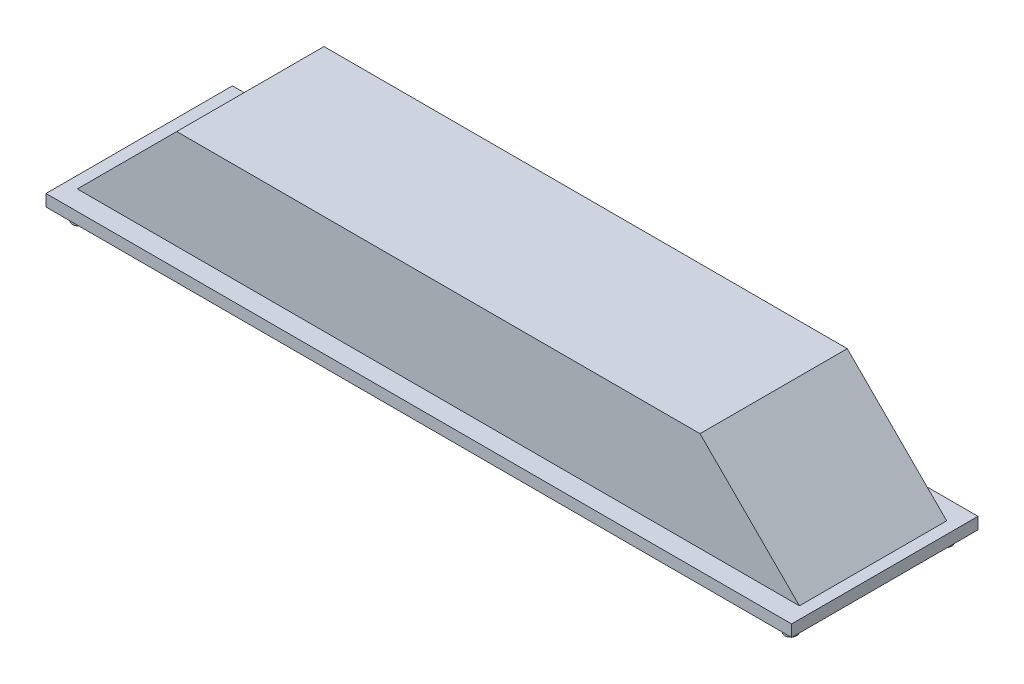
from build123d import *

# Parameters (mm, degrees)
SKETCH1_W               = 76.2
SKETCH1_H               = 19.05
BOSS_EXTRUDE1_DEPTH     = 1.2
BOSS_EXTRUDE2_START     = -2
BOSS_EXTRUDE2_DEPTH     = 15.05
SHELL1_START            = -6.325
SHELL1_DEPTH            = 12.65
SKETCH3_R               = 0.6
BOSS_EXTRUDE3_DEPTH     = 1.2
MIRROR2_COPY_1_SKETCH_R = 0.6
MIRROR2_COPY_1_DEPTH    = 1.2


# Read off the part's stored shape, not the designer's step: Shell1
with BuildPart() as part:
    # Sketch1 → Boss-Extrude1 (new body)
    with BuildSketch(Plane(origin=(0, 0, 0), x_dir=(1, 0, 0), z_dir=(0, 1, 0))):
        Rectangle(SKETCH1_W, SKETCH1_H)
    extrude(amount=BOSS_EXTRUDE1_DEPTH)

    # Sketch2 → Boss-Extrude2 (add)
    with BuildSketch(Plane.XY.offset(9.525).offset(BOSS_EXTRUDE2_START)):
        Polygon((-36.9, 1.2), (-26.74, 11.36), (26.74, 11.36), (36.9, 1.2), align=None)
    extrude(amount=-BOSS_EXTRUDE2_DEPTH)

    # Shell1 outline → Shell1 (cut)
    with BuildSketch(Plane.XY.offset(SHELL1_START)):
        Polygon((26.242943725, 10.16), (-26.242943725, 10.16), (-36.402943725, 0), (36.402943725, 0), align=None)
    extrude(amount=SHELL1_DEPTH, mode=Mode.SUBTRACT)

    # Sketch3 → Boss-Extrude3 (add)
    with BuildSketch(Plane.XZ):
        with Locations(Location((-36.402943725, 7.924066334, 0), (0, 0, 90))):
            Circle(SKETCH3_R)
    boss_extrude3 = extrude(amount=BOSS_EXTRUDE3_DEPTH)

    # Mirror1: Boss-Extrude3 across plane
    add(boss_extrude3.mirror(Plane.XY))

    # Mirror2: Boss-Extrude3 across plane
    add(boss_extrude3.mirror(Plane(origin=(0, 0, 0), x_dir=(0, 0, 1), z_dir=(1, 0, 0))))

    # Mirror2 copy 1 sketch → Mirror2 copy 1 (add)
    with BuildSketch(Plane(origin=(0, 0, 0), x_dir=(-1, 0, 0), z_dir=(0, -1, 0))):
        with Locations(Location((-36.402943725, 7.924066334, 0), (0, 0, 90))):
            Circle(MIRROR2_COPY_1_SKETCH_R)
    extrude(amount=MIRROR2_COPY_1_DEPTH)


solid = part.part
